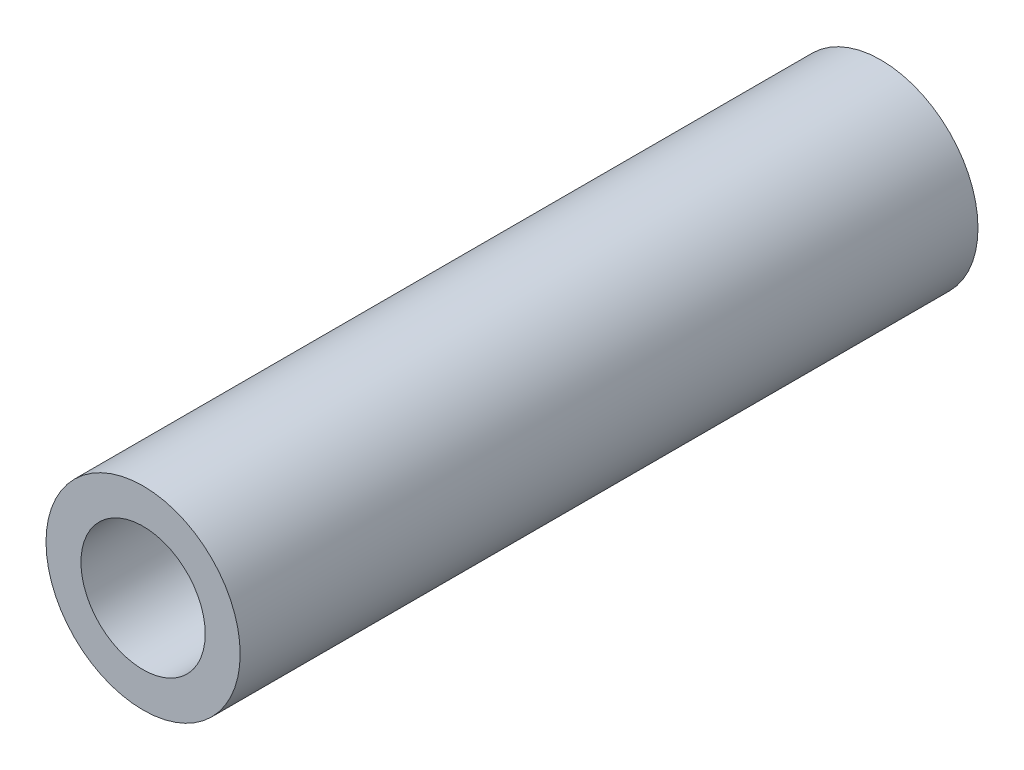
from build123d import *

# Parameters (mm, degrees)
SKETCH1_R           = 2.5
BOSS_EXTRUDE1_DEPTH = 19
CUT_EXTRUDE1_REACH  = 42.342
SKETCH3_R           = 1.6


with BuildPart() as part:
    # Sketch1 → Boss-Extrude1 (new body)
    with BuildSketch(Plane.XY):
        with Locations((33, 0)):
            Circle(SKETCH1_R)
    extrude(amount=BOSS_EXTRUDE1_DEPTH)

    # Sketch3 → Cut-Extrude1 (cut, up to next)
    with BuildSketch(Plane.XY.offset(19), mode=Mode.PRIVATE) as cut_extrude1_sk1:
        with Locations((33, 0)):
            Circle(SKETCH3_R)
    cut_extrude1_tool1 = extrude(cut_extrude1_sk1.sketch, amount=-CUT_EXTRUDE1_REACH, mode=Mode.PRIVATE) & part.part
    add(cut_extrude1_tool1.solids().sort_by_distance((33, 0, 19))[0], mode=Mode.SUBTRACT)


solid = part.part
